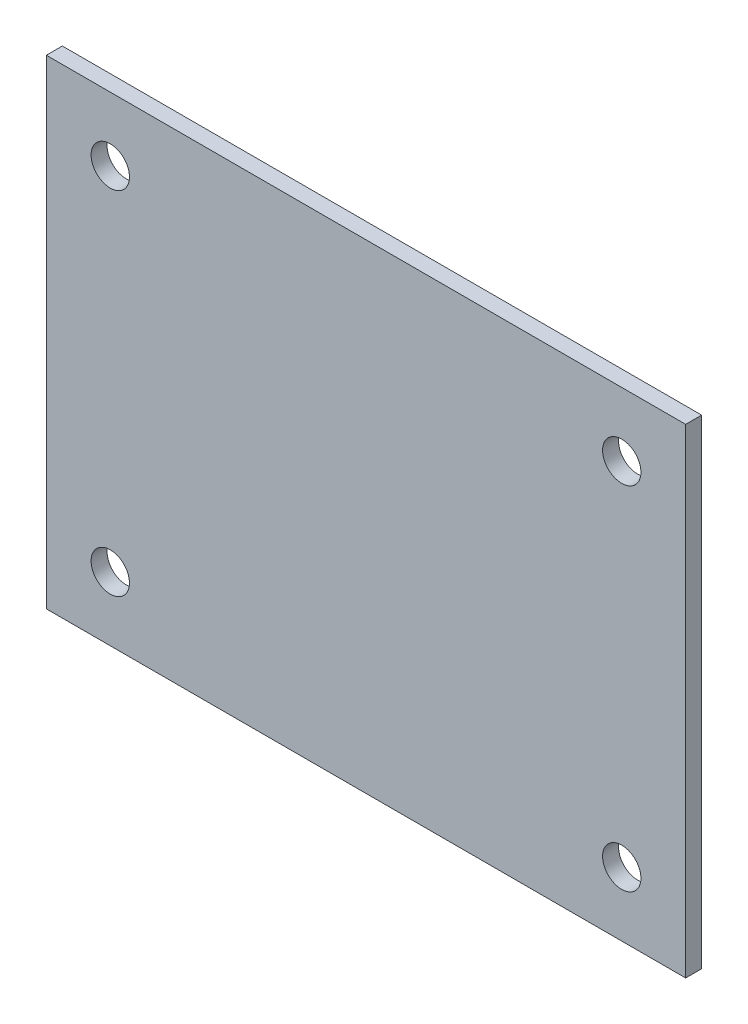
from build123d import *

# Parameters (mm, degrees)
STOCK_POST_1_START     = -5
STOCK_POST_1_OUTLINE_W = 200
STOCK_POST_1_OUTLINE_H = 150
STOCK_POST_1_DEPTH     = 5
F_12_0MM_DOWEL_HOLE1_D = 12


# Read off the part's stored shape, not the designer's step: Stock-Post-1
with BuildPart() as part:
    # Stock-Post-1 outline → Stock-Post-1 (new body)
    with BuildSketch(Plane.XY.offset(STOCK_POST_1_START)):
        with Locations((50, 25)):
            Rectangle(STOCK_POST_1_OUTLINE_W, STOCK_POST_1_OUTLINE_H)
    extrude(amount=STOCK_POST_1_DEPTH)

    # Ø12.0mm Dowel Hole1 (through all)
    with Locations(Plane.XY):
        with Locations((-30, -30), (-30, 80), (130, 80), (130, -30)):
            Hole(F_12_0MM_DOWEL_HOLE1_D / 2)


solid = part.part
